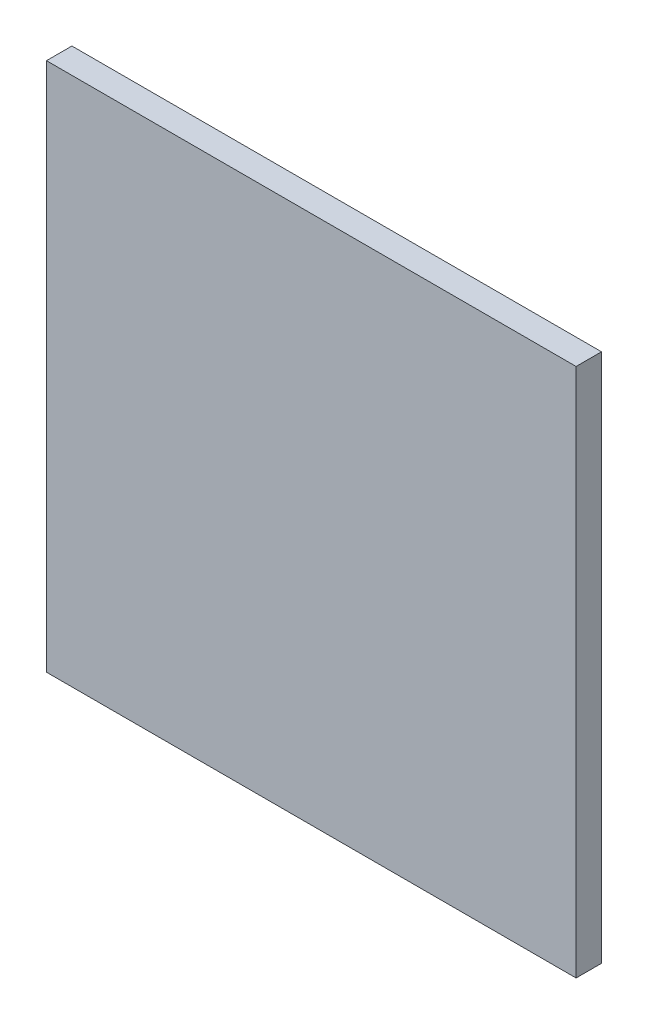
from build123d import *

# Parameters (mm, degrees)
SKETCH1_W           = 250
SKETCH1_H           = 250
BOSS_EXTRUDE1_DEPTH = 12


with BuildPart() as part:
    # Sketch1 → Boss-Extrude1 (new body)
    with BuildSketch(Plane.XY):
        with Locations((125, 125)):
            Rectangle(SKETCH1_W, SKETCH1_H)
    extrude(amount=BOSS_EXTRUDE1_DEPTH)


solid = part.part
